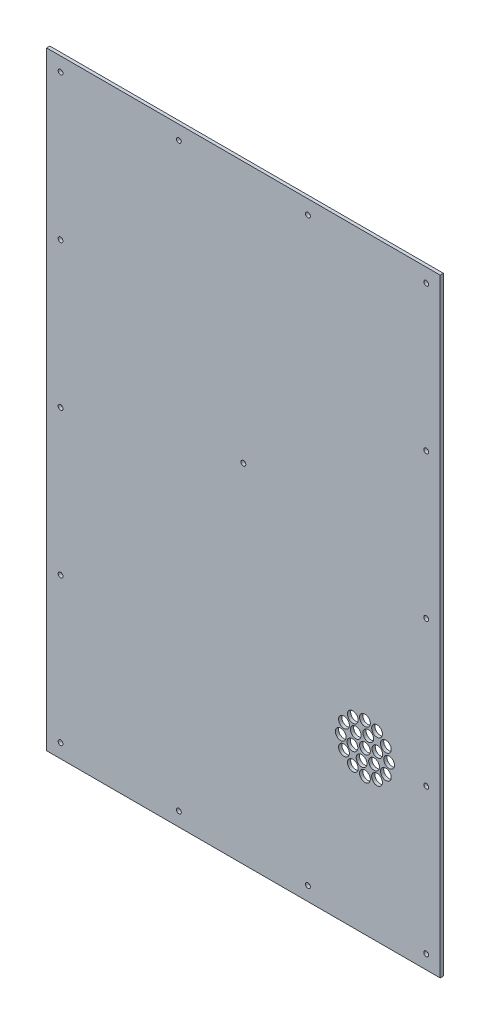
from build123d import *

# Parameters (mm, degrees)
SKETCH_1_W          = 366
SKETCH_1_H          = 566
EXTRUDE_1_DEPTH     = 3
SKETCH_5_R          = 2.25
CUT_EXTRUDE_2_DEPTH = 675.033381963
SKETCH1_R           = 2.25
CUT_EXTRUDE1_DEPTH  = 675.033381963
SKETCH_6_R          = 5
CUT_EXTRUDE_3_DEPTH = 675.033381963


with BuildPart() as part:
    # Эскиз1 → Бобышка-Вытянуть1 (new body)
    with BuildSketch(Plane.XY):
        with Locations((183, 283)):
            Rectangle(SKETCH_1_W, SKETCH_1_H)
    extrude(amount=EXTRUDE_1_DEPTH)

    # Эскиз5 → Вырез-Вытянуть2 (cut, through all)
    with BuildSketch(Plane(origin=(0, 0, 0), x_dir=(-1, 0, 0), z_dir=(0, 0, -1))):
        with Locations((-353, 553)):
            Circle(SKETCH_5_R)
        with Locations((-13, 553)):
            Circle(SKETCH_5_R)
        with Locations((-243, 553)):
            Circle(SKETCH_5_R)
        with Locations((-123, 553)):
            Circle(SKETCH_5_R)
        with Locations((-353, 418)):
            Circle(SKETCH_5_R)
        with Locations((-353, 283)):
            Circle(SKETCH_5_R)
        with Locations((-353, 148)):
            Circle(SKETCH_5_R)
        with Locations((-353, 13)):
            Circle(SKETCH_5_R)
        with Locations((-123, 13)):
            Circle(SKETCH_5_R)
        with Locations((-243, 13)):
            Circle(SKETCH_5_R)
        with Locations((-13, 418)):
            Circle(SKETCH_5_R)
        with Locations((-13, 283)):
            Circle(SKETCH_5_R)
        with Locations((-13, 148)):
            Circle(SKETCH_5_R)
        with Locations((-13, 13)):
            Circle(SKETCH_5_R)
    extrude(amount=-CUT_EXTRUDE_2_DEPTH, mode=Mode.SUBTRACT)

    # Sketch1 → Cut-Extrude1 (cut, through all)
    with BuildSketch(Plane.XY.offset(3)):
        with Locations((183, 323)):
            Circle(SKETCH1_R)
    extrude(amount=-CUT_EXTRUDE1_DEPTH, mode=Mode.SUBTRACT)

    # Эскиз6 → Вырез-Вытянуть3 (cut, through all)
    with BuildSketch(Plane(origin=(0, 0, 0), x_dir=(-1, 0, 0), z_dir=(0, 0, -1))):
        with Locations((-296, 127.5)):
            Circle(SKETCH_6_R)
        with Locations((-307.25, 130.514428415)):
            Circle(SKETCH_6_R)
        with Locations((-315.485571585, 138.75)):
            Circle(SKETCH_6_R)
        with Locations((-318.5, 150)):
            Circle(SKETCH_6_R)
        with Locations((-315.485571585, 161.25)):
            Circle(SKETCH_6_R)
        with Locations((-307.25, 169.485571585)):
            Circle(SKETCH_6_R)
        with Locations((-296, 172.5)):
            Circle(SKETCH_6_R)
        with Locations((-284.75, 169.485571585)):
            Circle(SKETCH_6_R)
        with Locations((-276.514428415, 161.25)):
            Circle(SKETCH_6_R)
        with Locations((-273.5, 150)):
            Circle(SKETCH_6_R)
        with Locations((-292.894171459, 138.408890085)):
            Circle(SKETCH_6_R)
        with Locations((-304.485281374, 141.514718626)):
            Circle(SKETCH_6_R)
        with Locations((-307.591109915, 153.105828541)):
            Circle(SKETCH_6_R)
        with Locations((-299.105828541, 161.591109915)):
            Circle(SKETCH_6_R)
        with Locations((-287.514718626, 158.485281374)):
            Circle(SKETCH_6_R)
        with Locations((-296, 150)):
            Circle(SKETCH_6_R)
        with Locations((-276.514428415, 138.75)):
            Circle(SKETCH_6_R)
        with Locations((-284.408890085, 146.894171459)):
            Circle(SKETCH_6_R)
        with Locations((-284.75, 130.514428415)):
            Circle(SKETCH_6_R)
    extrude(amount=-CUT_EXTRUDE_3_DEPTH, mode=Mode.SUBTRACT)


solid = part.part
